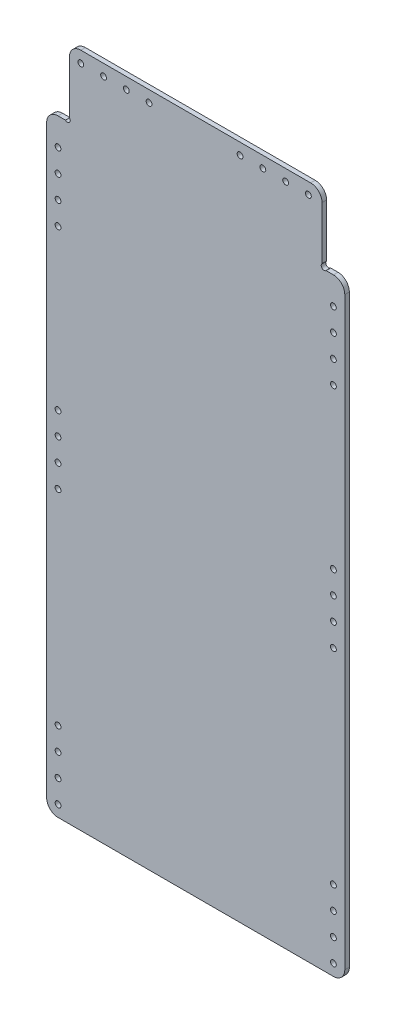
from build123d import *

# Parameters (mm, degrees)
SKETCH1_R           = 2.55
BOSS_EXTRUDE1_DEPTH = 4
FILLET1_R           = 10


with BuildPart() as part:
    # Sketch1 → Boss-Extrude1 (new body)
    with BuildSketch(Plane.XY):
        with BuildLine():
            Line((114.535533906, 534), (131, 534))
            Line((131, 534), (131, 0))
            Line((131, 0), (-131, 0))
            Line((-131, 0), (-131, 534))
            Line((-131, 534), (-114.535533906, 534))
            ThreePointArc((-114.535533906, 534), (-111, 534), (-111, 537.535533906))
            Line((-111, 537.535533906), (-111, 594))
            Line((-111, 594), (111, 594))
            Line((111, 594), (111, 537.535533906))
            ThreePointArc((111, 537.535533906), (111, 534), (114.535533906, 534))
        make_face()
        with Locations((-121, 10)):
            Circle(SKETCH1_R, mode=Mode.SUBTRACT)
        with Locations((-121, 30)):
            Circle(SKETCH1_R, mode=Mode.SUBTRACT)
        with Locations((-121, 50)):
            Circle(SKETCH1_R, mode=Mode.SUBTRACT)
        with Locations((-121, 70)):
            Circle(SKETCH1_R, mode=Mode.SUBTRACT)
        with Locations((-121, 250)):
            Circle(SKETCH1_R, mode=Mode.SUBTRACT)
        with Locations((-121, 270)):
            Circle(SKETCH1_R, mode=Mode.SUBTRACT)
        with Locations((-121, 290)):
            Circle(SKETCH1_R, mode=Mode.SUBTRACT)
        with Locations((-121, 310)):
            Circle(SKETCH1_R, mode=Mode.SUBTRACT)
        with Locations((-121, 450)):
            Circle(SKETCH1_R, mode=Mode.SUBTRACT)
        with Locations((-121, 470)):
            Circle(SKETCH1_R, mode=Mode.SUBTRACT)
        with Locations((-121, 490)):
            Circle(SKETCH1_R, mode=Mode.SUBTRACT)
        with Locations((-121, 510)):
            Circle(SKETCH1_R, mode=Mode.SUBTRACT)
        with Locations((-101, 584)):
            Circle(SKETCH1_R, mode=Mode.SUBTRACT)
        with Locations((-81, 584)):
            Circle(SKETCH1_R, mode=Mode.SUBTRACT)
        with Locations((-61, 584)):
            Circle(SKETCH1_R, mode=Mode.SUBTRACT)
        with Locations((-41, 584)):
            Circle(SKETCH1_R, mode=Mode.SUBTRACT)
        with Locations((39, 584)):
            Circle(SKETCH1_R, mode=Mode.SUBTRACT)
        with Locations((59, 584)):
            Circle(SKETCH1_R, mode=Mode.SUBTRACT)
        with Locations((79, 584)):
            Circle(SKETCH1_R, mode=Mode.SUBTRACT)
        with Locations((99, 584)):
            Circle(SKETCH1_R, mode=Mode.SUBTRACT)
        with Locations((121, 10)):
            Circle(SKETCH1_R, mode=Mode.SUBTRACT)
        with Locations((121, 510)):
            Circle(SKETCH1_R, mode=Mode.SUBTRACT)
        with Locations((121, 490)):
            Circle(SKETCH1_R, mode=Mode.SUBTRACT)
        with Locations((121, 470)):
            Circle(SKETCH1_R, mode=Mode.SUBTRACT)
        with Locations((121, 450)):
            Circle(SKETCH1_R, mode=Mode.SUBTRACT)
        with Locations((121, 310)):
            Circle(SKETCH1_R, mode=Mode.SUBTRACT)
        with Locations((121, 290)):
            Circle(SKETCH1_R, mode=Mode.SUBTRACT)
        with Locations((121, 270)):
            Circle(SKETCH1_R, mode=Mode.SUBTRACT)
        with Locations((121, 250)):
            Circle(SKETCH1_R, mode=Mode.SUBTRACT)
        with Locations((121, 70)):
            Circle(SKETCH1_R, mode=Mode.SUBTRACT)
        with Locations((121, 50)):
            Circle(SKETCH1_R, mode=Mode.SUBTRACT)
        with Locations((121, 30)):
            Circle(SKETCH1_R, mode=Mode.SUBTRACT)
    extrude(amount=BOSS_EXTRUDE1_DEPTH)

    # Fillet1
    fillet1_edges = [part.edges().sort_by_distance(p)[0] for p in [
        (-131, 0, 2),
        (131, 0, 2),
        (131, 534, 2),
        (111, 594, 2),
        (-111, 594, 2),
        (-131, 534, 2),
    ]]
    fillet(fillet1_edges, radius=FILLET1_R)


solid = part.part
